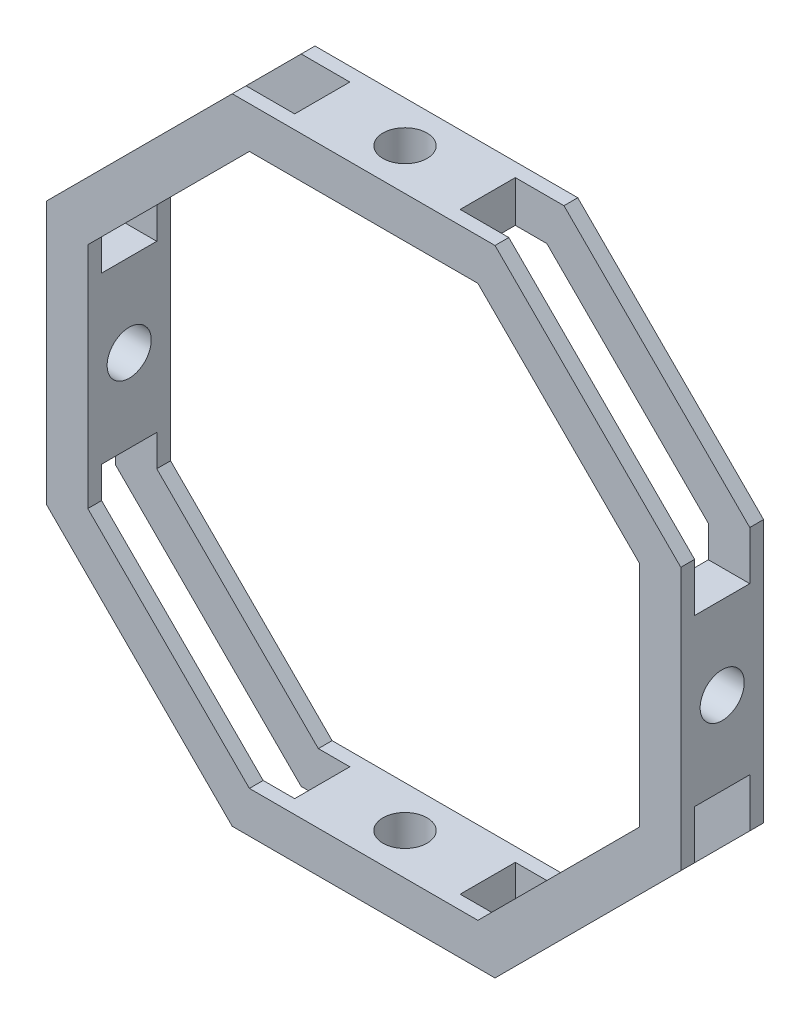
from build123d import *

# Parameters (mm, degrees)
RESSALTO_EXTRUS_O1_DEPTH   = 30
CORTE_EXTRUS_O1_DEPTH      = 259.89186932
CORTE_EXTRUS_O1_DEPTH_BACK = 259.89186932
ESBO_O2_R                  = 8
ESBO_O2_W                  = 20
ESBO_O2_H                  = 17.634559673
CORTE_EXTRUS_O2_DEPTH      = 259.89186932
CORTE_EXTRUS_O2_DEPTH_BACK = 259.89186932
ESBO_O3_R                  = 8
ESBO_O3_W                  = 17.634559673
ESBO_O3_H                  = 20
CORTE_EXTRUS_O3_DEPTH      = 280.250691539
CORTE_EXTRUS_O3_DEPTH_BACK = 280.250691539
ESBO_O4_W                  = 20
ESBO_O4_H                  = 95.269119346
CORTE_EXTRUS_O4_DEPTH      = 280.250691539
CORTE_EXTRUS_O4_DEPTH_BACK = 280.250691539
ESBO_O5_W                  = 20
ESBO_O5_H                  = 95.269119346


with BuildPart() as part:
    # Esboço1 → Ressalto-extrusão1 (new body)
    with BuildSketch(Plane.XY):
        Polygon((115, 47.634559673), (47.634559673, 115), (-47.634559673, 115), (-115, 47.634559673), (-115, -47.634559673), (-47.634559673, -115), (47.634559673, -115), (115, -47.634559673), align=None)
        Polygon((100, 41.421356237), (41.421356237, 100), (-41.421356237, 100), (-100, 41.421356237), (-100, -41.421356237), (-41.421356237, -100), (41.421356237, -100), (100, -41.421356237), align=None, mode=Mode.SUBTRACT)
    extrude(amount=RESSALTO_EXTRUS_O1_DEPTH)

    # Esboço2 → Corte-extrusão1 (cut, two sides: drawn at the far end of the back side and taken through both)
    with BuildSketch(Plane(origin=(115, 0, 0), x_dir=(0, 0, -1), z_dir=(1, 0, 0)).offset(-CORTE_EXTRUS_O1_DEPTH_BACK)):
        with Locations((-15, 0)):
            Circle(ESBO_O2_R)
        with Locations((-15, 38.817279837)):
            Rectangle(ESBO_O2_W, ESBO_O2_H)
        with Locations((-15, -38.817279837)):
            Rectangle(ESBO_O2_W, ESBO_O2_H)
    extrude(amount=CORTE_EXTRUS_O1_DEPTH + CORTE_EXTRUS_O1_DEPTH_BACK, mode=Mode.SUBTRACT)

    # Esboço3 → Corte-extrusão2 (cut, two sides: drawn at the far end of the back side and taken through both)
    with BuildSketch(Plane(origin=(0, 115, 0), x_dir=(1, 0, 0), z_dir=(0, 1, 0)).offset(-CORTE_EXTRUS_O2_DEPTH_BACK)):
        with Locations((0, -15)):
            Circle(ESBO_O3_R)
        with Locations((38.817279837, -15)):
            Rectangle(ESBO_O3_W, ESBO_O3_H)
        with Locations((-38.817279837, -15)):
            Rectangle(ESBO_O3_W, ESBO_O3_H)
    extrude(amount=CORTE_EXTRUS_O2_DEPTH + CORTE_EXTRUS_O2_DEPTH_BACK, mode=Mode.SUBTRACT)

    # Esboço4 → Corte-extrusão3 (cut, two sides: drawn at the far end of the back side and taken through both)
    with BuildSketch(Plane(origin=(81.317279836, 81.317279836, 0), x_dir=(0, 0, -1), z_dir=(0.7071067811865477, 0.7071067811865475, 0)).offset(-CORTE_EXTRUS_O3_DEPTH_BACK)):
        with Locations((-15, 0)):
            Rectangle(ESBO_O4_W, ESBO_O4_H)
    extrude(amount=CORTE_EXTRUS_O3_DEPTH + CORTE_EXTRUS_O3_DEPTH_BACK, mode=Mode.SUBTRACT)

    # Esboço5 → Corte-extrusão4 (cut, two sides: drawn at the far end of the back side and taken through both)
    with BuildSketch(Plane(origin=(-81.317279836, 81.317279836, 0), x_dir=(0, 0, 1), z_dir=(-0.7071067811865476, 0.7071067811865475, 0)).offset(-CORTE_EXTRUS_O4_DEPTH_BACK)):
        with Locations((15, 0)):
            Rectangle(ESBO_O5_W, ESBO_O5_H)
    extrude(amount=CORTE_EXTRUS_O4_DEPTH + CORTE_EXTRUS_O4_DEPTH_BACK, mode=Mode.SUBTRACT)


solid = part.part
